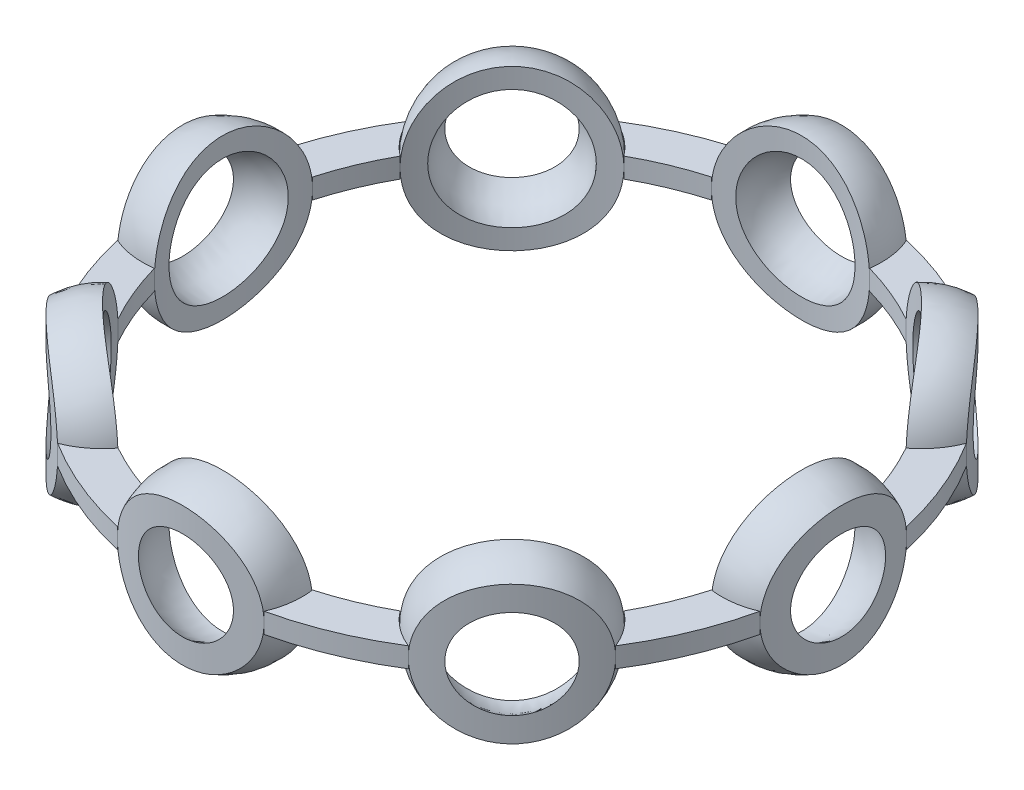
from build123d import *

# Parameters (mm, degrees)
CUT_EXTRUDE3_DEPTH      = 20.345542122
CUT_EXTRUDE3_DEPTH_BACK = 20.345542122
SKETCH10_R              = 27.215870579
SKETCH10_R_2            = 16.5
SKETCH10_R_3            = 14.5
CIRPATTERN6_COUNT       = 8
BOSS_EXTRUDE2_DEPTH     = 0.5
BOSS_EXTRUDE2_2_DEPTH   = 0.5
BOSS_EXTRUDE2_3_DEPTH   = 0.5
BOSS_EXTRUDE2_4_DEPTH   = 0.5
BOSS_EXTRUDE2_5_DEPTH   = 0.5
BOSS_EXTRUDE2_6_DEPTH   = 0.5
BOSS_EXTRUDE2_7_DEPTH   = 0.5
BOSS_EXTRUDE2_8_DEPTH   = 0.5


with BuildPart() as part:
    # Sketch4 → Revolve9 (revolve)
    with BuildSketch(Plane(origin=(14.5, 0, 0), x_dir=(0, 0, -1), z_dir=(1, 0, 0))):
        with BuildLine():
            Line((3, 0), (4, 0))
            ThreePointArc((4, 0), (0, 4), (-4, 0))
            Line((-4, 0), (-3, 0))
            ThreePointArc((-3, 0), (0, 3), (3, 0))
        make_face()
    revolve(axis=Axis((14.5, 0, -7.409492018), (0, 0, 1)))

    # Sketch10 → Cut-Extrude3 (cut, two sides: drawn at the far end of the back side and taken through both)
    # profile 1 of 2: a face of its own
    with BuildSketch(Plane(origin=(0, 0, 0), x_dir=(1, 0, 0), z_dir=(0, 1, 0)).offset(-CUT_EXTRUDE3_DEPTH_BACK)):
        Circle(SKETCH10_R)
        Circle(SKETCH10_R_2, mode=Mode.SUBTRACT)
    # profile 2 of 2: a face of its own
    with BuildSketch(Plane(origin=(0, 0, 0), x_dir=(1, 0, 0), z_dir=(0, 1, 0)).offset(-CUT_EXTRUDE3_DEPTH_BACK)):
        Circle(SKETCH10_R_3)
    extrude(amount=CUT_EXTRUDE3_DEPTH + CUT_EXTRUDE3_DEPTH_BACK, mode=Mode.SUBTRACT)


with BuildPart() as cirpattern6_1:
    # CirPattern6: pattern copy
    add(part.part.rotate(Axis((0, 4.875979646, 0), (0, -1, 0)), 1 * 360 / CIRPATTERN6_COUNT))


with BuildPart() as cirpattern6_2:
    # CirPattern6: pattern copy
    add(part.part.rotate(Axis((0, 4.875979646, 0), (0, -1, 0)), 2 * 360 / CIRPATTERN6_COUNT))


with BuildPart() as cirpattern6_3:
    # CirPattern6: pattern copy
    add(part.part.rotate(Axis((0, 4.875979646, 0), (0, -1, 0)), 3 * 360 / CIRPATTERN6_COUNT))


with BuildPart() as cirpattern6_4:
    # CirPattern6: pattern copy
    add(part.part.rotate(Axis((0, 4.875979646, 0), (0, -1, 0)), 4 * 360 / CIRPATTERN6_COUNT))


with BuildPart() as cirpattern6_5:
    # CirPattern6: pattern copy
    add(part.part.rotate(Axis((0, 4.875979646, 0), (0, -1, 0)), 5 * 360 / CIRPATTERN6_COUNT))


with BuildPart() as cirpattern6_6:
    # CirPattern6: pattern copy
    add(part.part.rotate(Axis((0, 4.875979646, 0), (0, -1, 0)), 6 * 360 / CIRPATTERN6_COUNT))


with BuildPart() as cirpattern6_7:
    # CirPattern6: pattern copy
    add(part.part.rotate(Axis((0, 4.875979646, 0), (0, -1, 0)), 7 * 360 / CIRPATTERN6_COUNT))


with BuildPart() as body_9:
    # Sketch12 → Boss-Extrude2 (new, symmetric)
    with BuildSketch(Plane(origin=(0, 0, 0), x_dir=(1, 0, 0), z_dir=(0, 1, 0))):
        with BuildLine():
            ThreePointArc((-16.086206897, -3.672049521), (-15.244012286, -6.314276634), (-13.971197097, -8.778134863))
            ThreePointArc((-13.971197097, -8.778134863), (-13.435674941, -7.830056821), (-12.664313001, -7.061527895))
            ThreePointArc((-12.664313001, -7.061527895), (-13.396253221, -5.548909769), (-13.948275862, -3.961767342))
            ThreePointArc((-13.948275862, -3.961767342), (-15.037143136, -3.963770585), (-16.086206897, -3.672049521))
        make_face()
    extrude(amount=BOSS_EXTRUDE2_DEPTH, both=True)


with BuildPart() as body_10:
    # Sketch12 → Boss-Extrude2 2 (new, symmetric)
    with BuildSketch(Plane(origin=(0, 0, 0), x_dir=(1, 0, 0), z_dir=(0, 1, 0))):
        with BuildLine():
            ThreePointArc((16.086206897, 3.672049521), (15.037143136, 3.963770585), (13.948275862, 3.961767342))
            ThreePointArc((13.948275862, 3.961767342), (13.396253221, 5.548909769), (12.664313001, 7.061527895))
            ThreePointArc((12.664313001, 7.061527895), (13.435674941, 7.830056821), (13.971197097, 8.778134863))
            ThreePointArc((13.971197097, 8.778134863), (15.244012286, 6.314276634), (16.086206897, 3.672049521))
        make_face()
    extrude(amount=BOSS_EXTRUDE2_2_DEPTH, both=True)


with BuildPart() as body_11:
    # Sketch12 → Boss-Extrude2 3 (new, symmetric)
    with BuildSketch(Plane(origin=(0, 0, 0), x_dir=(1, 0, 0), z_dir=(0, 1, 0))):
        with BuildLine():
            ThreePointArc((13.971197097, -8.778134863), (13.435674941, -7.830056821), (12.664313001, -7.061527895))
            ThreePointArc((12.664313001, -7.061527895), (13.396253221, -5.548909769), (13.948275862, -3.961767342))
            ThreePointArc((13.948275862, -3.961767342), (15.037143136, -3.963770585), (16.086206897, -3.672049521))
            ThreePointArc((16.086206897, -3.672049521), (15.244012286, -6.314276634), (13.971197097, -8.778134863))
        make_face()
    extrude(amount=BOSS_EXTRUDE2_3_DEPTH, both=True)


with BuildPart() as body_12:
    # Sketch12 → Boss-Extrude2 4 (new, symmetric)
    with BuildSketch(Plane(origin=(0, 0, 0), x_dir=(1, 0, 0), z_dir=(0, 1, 0))):
        with BuildLine():
            ThreePointArc((-3.961767342, -13.948275862), (-3.963770585, -15.037143136), (-3.672049521, -16.086206897))
            ThreePointArc((-3.672049521, -16.086206897), (-6.314276634, -15.244012286), (-8.778134863, -13.971197097))
            ThreePointArc((-8.778134863, -13.971197097), (-7.830056821, -13.435674941), (-7.061527895, -12.664313001))
            ThreePointArc((-7.061527895, -12.664313001), (-5.548909769, -13.396253221), (-3.961767342, -13.948275862))
        make_face()
    extrude(amount=BOSS_EXTRUDE2_4_DEPTH, both=True)


with BuildPart() as body_13:
    # Sketch12 → Boss-Extrude2 5 (new, symmetric)
    with BuildSketch(Plane(origin=(0, 0, 0), x_dir=(1, 0, 0), z_dir=(0, 1, 0))):
        with BuildLine():
            ThreePointArc((-13.971197097, 8.778134863), (-13.435674941, 7.830056821), (-12.664313001, 7.061527895))
            ThreePointArc((-12.664313001, 7.061527895), (-13.396253221, 5.548909769), (-13.948275862, 3.961767342))
            ThreePointArc((-13.948275862, 3.961767342), (-15.037143136, 3.963770585), (-16.086206897, 3.672049521))
            ThreePointArc((-16.086206897, 3.672049521), (-15.244012286, 6.314276634), (-13.971197097, 8.778134863))
        make_face()
    extrude(amount=BOSS_EXTRUDE2_5_DEPTH, both=True)


with BuildPart() as body_14:
    # Sketch12 → Boss-Extrude2 6 (new, symmetric)
    with BuildSketch(Plane(origin=(0, 0, 0), x_dir=(1, 0, 0), z_dir=(0, 1, 0))):
        with BuildLine():
            ThreePointArc((-3.672049521, 16.086206897), (-3.963770585, 15.037143136), (-3.961767342, 13.948275862))
            ThreePointArc((-3.961767342, 13.948275862), (-5.548909769, 13.396253221), (-7.061527895, 12.664313001))
            ThreePointArc((-7.061527895, 12.664313001), (-7.830056821, 13.435674941), (-8.778134863, 13.971197097))
            ThreePointArc((-8.778134863, 13.971197097), (-6.314276634, 15.244012286), (-3.672049521, 16.086206897))
        make_face()
    extrude(amount=BOSS_EXTRUDE2_6_DEPTH, both=True)


with BuildPart() as body_15:
    # Sketch12 → Boss-Extrude2 7 (new, symmetric)
    with BuildSketch(Plane(origin=(0, 0, 0), x_dir=(1, 0, 0), z_dir=(0, 1, 0))):
        with BuildLine():
            ThreePointArc((8.778134863, 13.971197097), (7.830056821, 13.435674941), (7.061527895, 12.664313001))
            ThreePointArc((7.061527895, 12.664313001), (5.548909769, 13.396253221), (3.961767342, 13.948275862))
            ThreePointArc((3.961767342, 13.948275862), (3.963770585, 15.037143136), (3.672049521, 16.086206897))
            ThreePointArc((3.672049521, 16.086206897), (6.314276634, 15.244012286), (8.778134863, 13.971197097))
        make_face()
    extrude(amount=BOSS_EXTRUDE2_7_DEPTH, both=True)


with BuildPart() as body_16:
    # Sketch12 → Boss-Extrude2 8 (new, symmetric)
    with BuildSketch(Plane(origin=(0, 0, 0), x_dir=(1, 0, 0), z_dir=(0, 1, 0))):
        with BuildLine():
            ThreePointArc((7.061527895, -12.664313001), (7.830056821, -13.435674941), (8.778134863, -13.971197097))
            ThreePointArc((8.778134863, -13.971197097), (6.314276634, -15.244012286), (3.672049521, -16.086206897))
            ThreePointArc((3.672049521, -16.086206897), (3.963770585, -15.037143136), (3.961767342, -13.948275862))
            ThreePointArc((3.961767342, -13.948275862), (5.548909769, -13.396253221), (7.061527895, -12.664313001))
        make_face()
    extrude(amount=BOSS_EXTRUDE2_8_DEPTH, both=True)


solid = Compound([part.part, cirpattern6_1.part, cirpattern6_2.part, cirpattern6_3.part, cirpattern6_4.part, cirpattern6_5.part, cirpattern6_6.part, cirpattern6_7.part, body_9.part, body_10.part, body_11.part, body_12.part, body_13.part, body_14.part, body_15.part, body_16.part])
